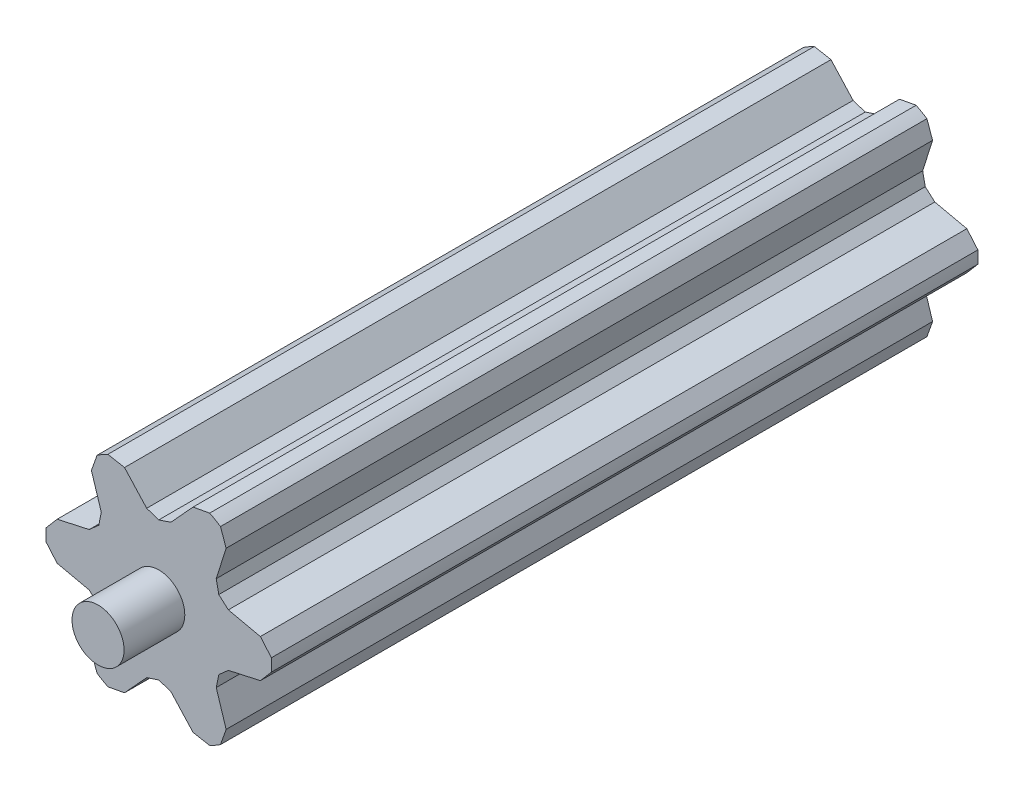
from build123d import *

# Parameters (mm, degrees)
SKETCH1_R           = 6.5
BOSS_EXTRUDE1_DEPTH = 40.71
CUT_EXTRUDE1_DEPTH  = 42.73492662
CIRPATTERN1_COUNT   = 6
SKETCH4_R           = 1.5
BOSS_EXTRUDE2_DEPTH = 3.5
SKETCH5_R           = 1.6
CUT_EXTRUDE2_DEPTH  = 15


with BuildPart() as part:
    # Sketch1 → Boss-Extrude1 (new body)
    with BuildSketch(Plane.XY):
        Circle(SKETCH1_R)
    extrude(amount=BOSS_EXTRUDE1_DEPTH)

    # Sketch2 → Cut-Extrude1 (cut, through all)
    with BuildSketch(Plane.XY):
        Polygon((0, 3.994046711), (-0.697770289, 4.226008341), (-1.974107131, 5.621832619), (-2.934011689, 5.800135809), (-3.466803954, 8.711819893), (0, 10.612735431), (3.466803954, 8.711819893), (2.934011689, 5.800135809), (1.974107131, 5.621832619), (0.697770289, 4.226008341), align=None)
    cut_extrude1 = extrude(amount=CUT_EXTRUDE1_DEPTH, mode=Mode.SUBTRACT)

    # CirPattern1: Cut-Extrude1 ×6 about axis
    cirpattern1_axis = Axis((0, 0, 40.71), (0, 0, -1))
    for i in range(1, CIRPATTERN1_COUNT):
        add(cut_extrude1.rotate(cirpattern1_axis, i * 360 / CIRPATTERN1_COUNT), mode=Mode.SUBTRACT)

    # Sketch4 → Boss-Extrude2 (add)
    with BuildSketch(Plane.XY.offset(40.71)):
        Circle(SKETCH4_R)
    extrude(amount=BOSS_EXTRUDE2_DEPTH)

    # Sketch5 → Cut-Extrude2 (cut)
    with BuildSketch(Plane.XY):
        Circle(SKETCH5_R)
    extrude(amount=CUT_EXTRUDE2_DEPTH, mode=Mode.SUBTRACT)


solid = part.part
